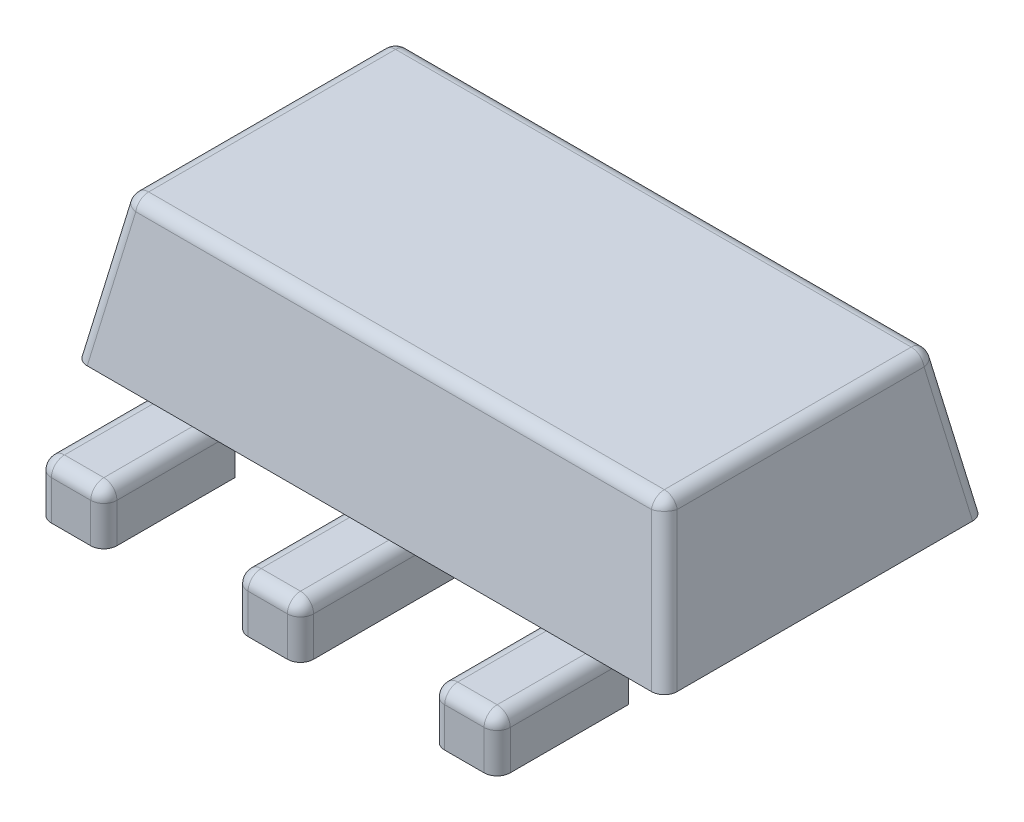
from build123d import *

# Parameters (mm, degrees)
EXTRUDE_1_DEPTH   = 0.4
SKETCH_1_W        = 0.5
SKETCH_1_H        = 1
EXTRUDE_1_2_DEPTH = 0.4
EXTRUDE_1_3_DEPTH = 0.4
FILLET_1_R        = 0.1
FILLET_2_R        = 0.1
FILLET_3_R        = 0.1
SKETCH_2_W        = 4.5
SKETCH_2_H        = 2.45
EXTRUDE_2_DEPTH   = 1.1
CHAMFER_1_SIZE    = 1.1
CHAMFER_1_SIZE_2  = 0.2
FILLET_4_R        = 0.1


with BuildPart() as part:
    # Эскиз1 → Бобышка-Вытянуть1 (new body)
    with BuildSketch(Plane(origin=(0, 0, 0), x_dir=(1, 0, 0), z_dir=(0, 1, 0))):
        with BuildLine():
            Line((-0.249947437, -1), (-0.249947437, -0.62054925))
            ThreePointArc((-0.249947437, -0.62054925), (-0.272783577, -0.50574422), (-0.337815403, -0.408417215))
            Line((-0.337815403, -0.408417215), (-0.726260523, -0.019972095))
            ThreePointArc((-0.726260523, -0.019972095), (-0.791292348, 0.077354909), (-0.814128489, 0.192159939))
            Line((-0.814128489, 0.192159939), (-0.814128489, 1.7))
            ThreePointArc((-0.814128489, 1.7), (-0.726260523, 1.912132034), (-0.514128489, 2))
            Line((-0.514128489, 2), (0.514128489, 2))
            ThreePointArc((0.514128489, 2), (0.726260523, 1.912132034), (0.814128489, 1.7))
            Line((0.814128489, 1.7), (0.814128489, 0.17511839))
            ThreePointArc((0.814128489, 0.17511839), (0.796627294, 0.074150944), (0.746165655, -0.015036161))
            Line((0.746165655, -0.015036161), (0.31791027, -0.537617218))
            ThreePointArc((0.31791027, -0.537617218), (0.267448632, -0.626804324), (0.249947437, -0.727771769))
            Line((0.249947437, -0.727771769), (0.249947437, -1))
            Line((0.249947437, -1), (0.249947437, -2))
            Line((0.249947437, -2), (-0.249947437, -2))
            Line((-0.249947437, -2), (-0.249947437, -1))
        make_face()
    extrude(amount=EXTRUDE_1_DEPTH)

    # Скругление1
    fillet_1_edges = [part.edges().sort_by_distance(p)[0] for p in [
        (0, 0.4, 2),
        (0.249947437, 0.4, 1.363885884),
        (0.267448632, 0.4, 0.626804324),
        (0.532037963, 0.4, 0.27632669),
        (0.249947437, 0.2, 2),
        (-0.249947437, 0.2, 2),
        (0.796627294, 0.4, -0.074150944),
        (0.814128489, 0.4, -0.937559195),
        (0.726260523, 0.4, -1.912132034),
        (0, 0.4, -2),
        (-0.272783577, 0.4, 0.50574422),
        (-0.726260523, 0.4, -1.912132034),
        (-0.814128489, 0.4, -0.94607997),
        (-0.791292348, 0.4, -0.077354909),
        (-0.532037963, 0.4, 0.214194655),
        (-0.249947437, 0.4, 1.310274625),
    ]]
    fillet(fillet_1_edges, radius=FILLET_1_R)


with BuildPart() as body_2:
    # Эскиз1 → Extrude 1 2 (new body)
    with BuildSketch(Plane(origin=(0, 0, 0), x_dir=(1, 0, 0), z_dir=(0, 1, 0))):
        with Locations((-1.5, -1.5)):
            Rectangle(SKETCH_1_W, SKETCH_1_H)
    extrude(amount=EXTRUDE_1_2_DEPTH)

    # Скругление2
    fillet_2_edges = [body_2.edges().sort_by_distance(p)[0] for p in [
        (-1.75, 0.4, 1.5),
        (-1.5, 0.4, 2),
        (-1.25, 0.4, 1.5),
        (-1.5, 0.4, 1),
        (-1.25, 0.2, 2),
        (-1.75, 0.2, 2),
    ]]
    fillet(fillet_2_edges, radius=FILLET_2_R)


with BuildPart() as body_3:
    # Эскиз1 → Extrude 1 3 (new body)
    with BuildSketch(Plane(origin=(0, 0, 0), x_dir=(1, 0, 0), z_dir=(0, 1, 0))):
        with Locations((1.5, -1.5)):
            Rectangle(SKETCH_1_W, SKETCH_1_H)
    extrude(amount=EXTRUDE_1_3_DEPTH)

    # Скругление3
    fillet_3_edges = [body_3.edges().sort_by_distance(p)[0] for p in [
        (1.25, 0.4, 1.5),
        (1.5, 0.4, 2),
        (1.75, 0.4, 1.5),
        (1.5, 0.4, 1),
        (1.75, 0.2, 2),
        (1.25, 0.2, 2),
    ]]
    fillet(fillet_3_edges, radius=FILLET_3_R)


with BuildPart() as body_4:
    # Эскиз2 → Бобышка-Вытянуть2 (new body)
    with BuildSketch(Plane(origin=(0, 0.4, 0), x_dir=(1, 0, 0), z_dir=(0, 1, 0))):
        Rectangle(SKETCH_2_W, SKETCH_2_H)
    extrude(amount=EXTRUDE_2_DEPTH)

    # Фаска1
    # the kernel refuses this chamfer: 1.1, 0.2 mm, written as the material it takes off along each edge
    with BuildSketch(Plane(origin=(5.108293424, 1.5, 1.225), x_dir=(0, -0.9999763028084744, 0.006884317068103953), z_dir=(-1, 0, 0)), Plane(origin=(-5.108293424, 1.5, -1.225), x_dir=(0, -0.9999763028084744, -0.006884317068103953), z_dir=(1, 0, 0))) as chamfer_1_piece_1:
        Polygon((CHAMFER_1_SIZE * 0.999976302808, -CHAMFER_1_SIZE * 0.0068843170681), (-CHAMFER_1_SIZE_2 * 0.0068843170681, -CHAMFER_1_SIZE_2 * 0.999976302808), (0, 0), align=None)
    extrude(amount=10.216586847, mode=Mode.SUBTRACT)
    with BuildSketch(Plane(origin=(-2.25, 1.5, 4.083293424), x_dir=(-0.006884317068103953, -0.9999763028084744, 0), z_dir=(0, 0, -1)), Plane(origin=(2.25, 1.5, -4.083293424), x_dir=(0.006884317068103953, -0.9999763028084744, 0), z_dir=(0, 0, 1))) as chamfer_1_piece_2:
        Polygon((CHAMFER_1_SIZE * 0.999976302808, -CHAMFER_1_SIZE * 0.0068843170681), (-CHAMFER_1_SIZE_2 * 0.0068843170681, -CHAMFER_1_SIZE_2 * 0.999976302808), (0, 0), align=None)
    extrude(amount=8.166586847, mode=Mode.SUBTRACT)

    # Скругление4
    fillet_4_edges = [body_4.edges().sort_by_distance(p)[0] for p in [
        (2.05, 1.5, 0),
        (0, 1.5, -1.025),
        (-2.05, 1.5, 0),
        (0, 1.5, 1.025),
        (-2.15, 0.95, -1.125),
        (2.15, 0.95, -1.125),
        (-2.15, 0.95, 1.125),
        (2.15, 0.95, 1.125),
    ]]
    fillet(fillet_4_edges, radius=FILLET_4_R)


solid = Compound([part.part, body_2.part, body_3.part, body_4.part])
